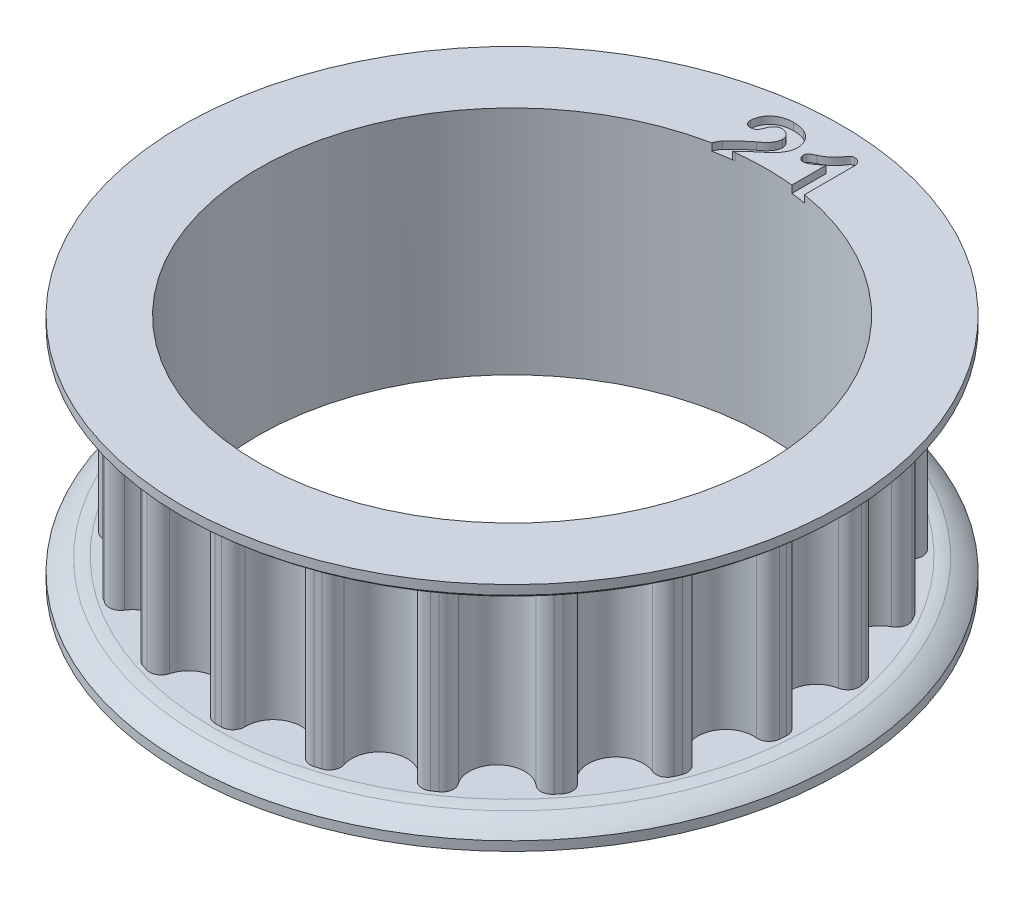
from build123d import *

# Parameters (mm, degrees)
SKETCH1_R               = 16.13976871
TOOTHOD_DEPTH           = 5.08
TOOTHPROFILE_DEPTH      = 25.984192363
TOOTHPATTERN_COUNT      = 21
BORE_DEPTH              = 27.384489599
BORE_DEPTH_BACK         = 27.384489599
SKETCH7_R               = 13.97
LARGE_TOOTH_COUNT_DEPTH = 0.4


with BuildPart() as part:
    # Sketch1 → ToothOD (new, symmetric)
    with BuildSketch(Plane(origin=(0, 0, 0), x_dir=(1, 0, 0), z_dir=(0, 1, 0))):
        Circle(SKETCH1_R)
    extrude(amount=TOOTHOD_DEPTH, both=True)

    # Sketch2 → ToothProfile (cut, through all)
    with BuildSketch(Plane(origin=(0, 5.08, 0), x_dir=(1, 0, 0), z_dir=(0, 1, 0))):
        with BuildLine():
            ThreePointArc((-1.514819148, 15.428848418), (0, 14.07976871), (1.514819148, 15.428848418))
            ThreePointArc((1.514819148, 15.428848418), (1.757165873, 15.857950358), (2.233452437, 15.984486987))
            ThreePointArc((2.233452437, 15.984486987), (0, 16.13976871), (-2.233452437, 15.984486987))
            ThreePointArc((-2.233452437, 15.984486987), (-1.757165873, 15.857950358), (-1.514819148, 15.428848418))
        make_face()
    toothprofile = extrude(amount=-TOOTHPROFILE_DEPTH, mode=Mode.SUBTRACT)

    # ToothPattern: ToothProfile ×21 about axis
    toothpattern_axis = Axis((0, 5.08, 0), (0, -1, 0))
    for i in range(1, TOOTHPATTERN_COUNT):
        add(toothprofile.rotate(toothpattern_axis, i * 360 / TOOTHPATTERN_COUNT), mode=Mode.SUBTRACT)

    # Sketch4 → Flange (revolve)
    with BuildSketch(Plane.XY):
        with BuildLine():
            Line((0, -5.08), (16.39376871, -5.08))
            ThreePointArc((16.39376871, -5.08), (16.7195247, -5.105622571), (17.039341039, -5.172637424))
            ThreePointArc((17.039341039, -5.172637424), (17.607069616, -5.454197125), (18.10826871, -5.842))
            Line((18.10826871, -5.842), (18.10826871, -6.35))
            Line((18.10826871, -6.35), (0, -6.35))
            Line((0, -6.35), (0, -5.08))
        make_face()
        with BuildLine():
            Line((18.10826871, 6.35), (18.10826871, 5.842))
            ThreePointArc((18.10826871, 5.842), (17.607069616, 5.454197125), (17.039341039, 5.172637424))
            ThreePointArc((17.039341039, 5.172637424), (16.7195247, 5.105622571), (16.39376871, 5.08))
            Line((16.39376871, 5.08), (0, 5.08))
            Line((0, 5.08), (0, 6.35))
            Line((0, 6.35), (18.10826871, 6.35))
        make_face()
    revolve(axis=Axis((0, 7.858125, 0), (0, -1, 0)))

    # Sketch7 → Bore (cut, two sides: drawn at the far end of the back side and taken through both)
    with BuildSketch(Plane.XZ.offset(-BORE_DEPTH_BACK)):
        Circle(SKETCH7_R)
    extrude(amount=BORE_DEPTH + BORE_DEPTH_BACK, mode=Mode.SUBTRACT)

    # Sketch9 → Large Tooth Count (cut)
    with BuildSketch(Plane(origin=(0, 6.35, 0), x_dir=(1, 0, 0), z_dir=(0, 1, 0))):
        with BuildLine():
            Line((-1.762125, 13.874923354), (-0.570755859, 13.874923354))
            add(Edge.make_bspline(
                [(-0.570755859, 13.874923354), (-0.533707207, 13.87398852), (-0.463545425, 13.872218156), (-0.365142268, 13.853642303), (-0.279792732, 13.823297538), (-0.208549734, 13.780908725), (-0.152090999, 13.729565586), (-0.111056396, 13.67153727), (-0.085797031, 13.607248318), (-0.082683368, 13.562107058), (-0.081111328, 13.539315932)],
                knots=[0, 0, 0, 0, 1.343135754, 2.543595783, 3.617176489, 4.61442092, 5.531765965, 6.365790276, 7.174912707, 8, 8, 8, 8], degree=3))
            add(Edge.make_bspline(
                [(-0.081111328, 13.539315932), (-0.082203127, 13.518835501), (-0.084392981, 13.477757305), (-0.104097817, 13.41789058), (-0.136223052, 13.361311518), (-0.17989453, 13.308411307), (-0.237387293, 13.262169059), (-0.311315716, 13.230655326), (-0.398880946, 13.211510069), (-0.46199946, 13.209332488), (-0.495597656, 13.208173354)],
                knots=[0, 0, 0, 0, 0.824179157, 1.653080055, 2.512971333, 3.436438535, 4.405072091, 5.457340227, 6.646533722, 8, 8, 8, 8], degree=3))
            Line((-0.495597656, 13.208173354), (-2.305347656, 13.208173354))
            add(Edge.make_bspline(
                [(-2.305347656, 13.208173354), (-2.337708251, 13.209585711), (-2.399445044, 13.212280174), (-2.487124104, 13.233091534), (-2.563929489, 13.269374607), (-2.628936518, 13.319379949), (-2.67994909, 13.379620035), (-2.717611602, 13.44590333), (-2.740998957, 13.517687637), (-2.743747646, 13.567670374), (-2.745134766, 13.592894057)],
                knots=[0, 0, 0, 0, 1.188346208, 2.267099395, 3.286301641, 4.287122075, 5.25691743, 6.166969209, 7.074964888, 8, 8, 8, 8], degree=3))
            add(Edge.make_bspline(
                [(-2.745134766, 13.592894057), (-2.744179889, 13.610580586), (-2.742139185, 13.648379169), (-2.72704257, 13.70774883), (-2.70583681, 13.773882187), (-2.675402152, 13.84383634), (-2.641188782, 13.913947291), (-2.603506466, 13.978442241), (-2.564081929, 14.035353764), (-2.534629659, 14.068174532), (-2.520404297, 14.08402687)],
                knots=[0, 0, 0, 0, 0.772497252, 1.650934469, 2.665768415, 3.807487169, 4.98083678, 6.074173258, 7.069831195, 8, 8, 8, 8], degree=3))
            add(Edge.make_bspline(
                [(-2.520404297, 14.08402687), (-2.466053132, 14.139560567), (-2.361152933, 14.246743107), (-2.205832985, 14.398276917), (-2.061164397, 14.53766544), (-1.945964026, 14.644447116), (-1.859956155, 14.722642098), (-1.801130055, 14.774408415), (-1.747617549, 14.821952202), (-1.697550942, 14.863044242), (-1.653169438, 14.900631234), (-1.612941668, 14.932596807), (-1.57736698, 14.959631323), (-1.554570298, 14.975096179), (-1.544091797, 14.982204604)],
                knots=[0, 0, 0, 0, 2.106460972, 4.065564631, 5.88232778, 7.552435621, 8.323665149, 9.033433807, 9.676767744, 10.26395234, 10.78914621, 11.253325952, 11.656791058, 12, 12, 12, 12], degree=3))
            add(Edge.make_bspline(
                [(-1.544091797, 14.982204604), (-1.512150488, 15.005011085), (-1.450036186, 15.049361449), (-1.362910525, 15.118140765), (-1.285488552, 15.187837086), (-1.215517545, 15.256252343), (-1.154259094, 15.325580203), (-1.101287219, 15.395509388), (-1.056278481, 15.465940278), (-1.018709146, 15.536455299), (-0.990117065, 15.607242181), (-0.96741796, 15.676560053), (-0.955657973, 15.745542042), (-0.953540426, 15.791049996), (-0.9525, 15.813409682)],
                knots=[0, 0, 0, 0, 1.334834965, 2.595771614, 3.772830874, 4.876488071, 5.92253324, 6.916378838, 7.85720954, 8.762924605, 9.629317751, 10.451189837, 11.239014127, 12, 12, 12, 12], degree=3))
            add(Edge.make_bspline(
                [(-0.9525, 15.813409682), (-0.95336502, 15.836539529), (-0.955052845, 15.881670448), (-0.968117239, 15.947580681), (-0.9896362, 16.009855495), (-1.020438978, 16.067574181), (-1.05762368, 16.12085656), (-1.101737406, 16.167955458), (-1.152277568, 16.208477239), (-1.208116574, 16.24252049), (-1.268172163, 16.270290822), (-1.332096405, 16.289379526), (-1.398736756, 16.301965511), (-1.444318349, 16.303181428), (-1.467445313, 16.303798354)],
                knots=[0, 0, 0, 0, 1.048524963, 2.045880207, 3.035079073, 4.026514865, 5.003545842, 5.974663832, 6.942844473, 7.932746918, 8.934660944, 9.934741294, 10.952139253, 12, 12, 12, 12], degree=3))
            add(Edge.make_bspline(
                [(-1.467445313, 16.303798354), (-1.488603837, 16.303246673), (-1.530328923, 16.302158745), (-1.591038054, 16.288605382), (-1.649193485, 16.268537667), (-1.704582037, 16.24000902), (-1.757128938, 16.202914471), (-1.806805489, 16.158002476), (-1.854552156, 16.105553337), (-1.88191115, 16.065543697), (-1.896070313, 16.044837416)],
                knots=[0, 0, 0, 0, 0.968576666, 1.910054901, 2.83824492, 3.784521401, 4.756498814, 5.779585462, 6.850863807, 8, 8, 8, 8], degree=3))
            add(Edge.make_bspline(
                [(-1.896070313, 16.044837416), (-1.898884837, 16.039169206), (-1.90725541, 16.022311594), (-1.919621651, 15.986084258), (-1.941429436, 15.932681203), (-1.964571994, 15.863127936), (-1.994294675, 15.788413168), (-2.02891906, 15.716314224), (-2.069030563, 15.652017002), (-2.110038336, 15.592107905), (-2.163240409, 15.542668437), (-2.230788188, 15.508340165), (-2.311915747, 15.488389198), (-2.370213456, 15.486338596), (-2.401341797, 15.485243666)],
                knots=[0, 0, 0, 0, 0.277128514, 0.824197545, 1.674066046, 2.805212172, 4.034469565, 5.196326461, 6.303667431, 7.353778336, 8.369399301, 9.448751033, 10.637748383, 12, 12, 12, 12], degree=3))
            add(Edge.make_bspline(
                [(-2.401341797, 15.485243666), (-2.424271026, 15.486353646), (-2.469130374, 15.488525239), (-2.533582425, 15.506574301), (-2.591105186, 15.538155264), (-2.642025052, 15.579899622), (-2.684486339, 15.632087381), (-2.713078119, 15.694699146), (-2.731809009, 15.76445846), (-2.73372109, 15.813773847), (-2.734716797, 15.839454604)],
                knots=[0, 0, 0, 0, 1.006577142, 1.969294067, 2.910545259, 3.870728958, 4.847838899, 5.837573602, 6.873926541, 8, 8, 8, 8], degree=3))
            add(Edge.make_bspline(
                [(-2.734716797, 15.839454604), (-2.733654173, 15.870272421), (-2.731508455, 15.932501712), (-2.715647187, 16.02641007), (-2.691165523, 16.121886301), (-2.656366941, 16.218238432), (-2.61099031, 16.312760147), (-2.556929288, 16.404438131), (-2.490968298, 16.489845053), (-2.417939183, 16.572390484), (-2.333218402, 16.647662124), (-2.237995489, 16.715825835), (-2.132080587, 16.775743586), (-2.016058379, 16.828333575), (-1.889529964, 16.870768082), (-1.752593036, 16.900820117), (-1.60590276, 16.920010724), (-1.504715272, 16.921932735), (-1.4525625, 16.922923354)],
                knots=[0, 0, 0, 0, 0.79066067, 1.596552158, 2.438066046, 3.318094126, 4.22076533, 5.12585777, 6.043865989, 6.985993145, 7.950839248, 8.945468985, 9.986194989, 11.068910188, 12.21037173, 13.404260134, 14.66213667, 16, 16, 16, 16], degree=3))
            add(Edge.make_bspline(
                [(-1.4525625, 16.922923354), (-1.419313755, 16.922468154), (-1.354251016, 16.921577398), (-1.258683499, 16.915382026), (-1.167205964, 16.906195634), (-1.079873649, 16.891678454), (-0.996460634, 16.874347587), (-0.917374073, 16.851581312), (-0.842094469, 16.826080755), (-0.794362208, 16.805187832), (-0.770929688, 16.794931166)],
                knots=[0, 0, 0, 0, 1.141710532, 2.234153931, 3.287715026, 4.297387598, 5.273071892, 6.211454997, 7.121975032, 8, 8, 8, 8], degree=3))
            add(Edge.make_bspline(
                [(-0.770929688, 16.794931166), (-0.737844503, 16.778689088), (-0.67280231, 16.746758773), (-0.5825276, 16.688840779), (-0.500121613, 16.625023812), (-0.427116332, 16.553849783), (-0.362358815, 16.477519254), (-0.304287189, 16.397223162), (-0.256045848, 16.310722103), (-0.215247684, 16.220671783), (-0.183300557, 16.127674135), (-0.160232052, 16.033549748), (-0.145256758, 15.938657135), (-0.143668356, 15.874980009), (-0.142875, 15.843175307)],
                knots=[0, 0, 0, 0, 1.100471427, 2.163417708, 3.198242748, 4.209796447, 5.203380146, 6.186404149, 7.165424876, 8.157237974, 9.136931722, 10.098602738, 11.050312444, 12, 12, 12, 12], degree=3))
            add(Edge.make_bspline(
                [(-0.142875, 15.843175307), (-0.144693042, 15.793175923), (-0.148288338, 15.69429892), (-0.1782964, 15.549150428), (-0.227637669, 15.410508707), (-0.295917887, 15.281042845), (-0.373499735, 15.162518378), (-0.451858766, 15.054395038), (-0.532509928, 14.961301112), (-0.602079602, 14.891836904), (-0.661927162, 14.839944468), (-0.71198559, 14.7964842), (-0.768326496, 14.748400074), (-0.831144563, 14.695093673), (-0.901057651, 14.637601356), (-0.976718868, 14.574007501), (-1.059338558, 14.506612059), (-1.146105933, 14.435918207), (-1.233051854, 14.364971252), (-1.314376052, 14.294877474), (-1.389833251, 14.229756169), (-1.4579485, 14.16759103), (-1.519166092, 14.108979255), (-1.574924824, 14.055043739), (-1.622231717, 14.003363641), (-1.651539483, 13.970210491), (-1.665386719, 13.954546401)],
                knots=[0, 0, 0, 0, 1.436599664, 2.840968415, 4.241909903, 5.655071448, 7.037977016, 8.313294046, 9.491515882, 10.57584574, 11.13676856, 11.768818006, 12.482089669, 13.266552005, 14.137751607, 15.08474532, 16.108481255, 17.203478555, 18.302996106, 19.33499709, 20.290440541, 21.168908746, 21.986178864, 22.727567017, 23.398805086, 24, 24, 24, 24], degree=3))
            add(Edge.make_bspline(
                [(-1.665386719, 13.954546401), (-1.67937404, 13.940422035), (-1.708903168, 13.910603585), (-1.743772519, 13.887226966), (-1.762125, 13.874923354)],
                knots=[0, 0, 0, 0, 0.947357495, 2, 2, 2, 2], degree=3))
        make_face()
        with BuildLine():
            Line((1.476375, 13.604056166), (1.476375, 15.779923354))
            add(Edge.make_bspline(
                [(1.476375, 15.779923354), (1.433479942, 15.742404022), (1.351801185, 15.67096147), (1.231124831, 15.573855748), (1.118877324, 15.491511634), (1.014858251, 15.424250162), (0.91959762, 15.371343071), (0.832873441, 15.333454932), (0.754394942, 15.308947935), (0.704095207, 15.305338583), (0.680888672, 15.303673354)],
                knots=[0, 0, 0, 0, 1.452107273, 2.765034543, 3.945897232, 4.997908399, 5.920070119, 6.718510474, 7.408765629, 8, 8, 8, 8], degree=3))
            add(Edge.make_bspline(
                [(0.680888672, 15.303673354), (0.660648096, 15.30474504), (0.62082535, 15.306853551), (0.563344568, 15.32602751), (0.509769291, 15.356301097), (0.461562481, 15.397678489), (0.420626666, 15.446753855), (0.391395595, 15.502103467), (0.372329937, 15.561153466), (0.370180192, 15.602177097), (0.36909375, 15.622909682)],
                knots=[0, 0, 0, 0, 0.982678269, 1.933390929, 2.917255113, 3.962257531, 5.008793131, 6.008019064, 6.993289668, 8, 8, 8, 8], degree=3))
            add(Edge.make_bspline(
                [(0.36909375, 15.622909682), (0.370251069, 15.646067612), (0.37243709, 15.689809852), (0.388189288, 15.750863632), (0.417435579, 15.801508307), (0.459981689, 15.841833093), (0.515171558, 15.876625624), (0.5819013, 15.914975223), (0.66255745, 15.95774059), (0.721920377, 15.985353382), (0.753814453, 16.000188979)],
                knots=[0, 0, 0, 0, 0.959800551, 1.812935176, 2.587130183, 3.350598702, 4.217563363, 5.286346087, 6.542028024, 8, 8, 8, 8], degree=3))
            add(Edge.make_bspline(
                [(0.753814453, 16.000188979), (0.800242248, 16.02270018), (0.889371027, 16.065915583), (1.013182235, 16.137073568), (1.123367651, 16.208566207), (1.219203096, 16.284425074), (1.305551889, 16.363664965), (1.386414567, 16.446340844), (1.461912646, 16.535024433), (1.530806341, 16.625266077), (1.5911005, 16.710227626), (1.643699201, 16.779799664), (1.684835404, 16.831855357), (1.715755856, 16.870868684), (1.749767884, 16.896809257), (1.792199878, 16.912487803), (1.844810487, 16.921754558), (1.883373089, 16.922512763), (1.904255859, 16.922923354)],
                knots=[0, 0, 0, 0, 1.633066382, 3.135044738, 4.518110351, 5.78750681, 6.999314836, 8.226621731, 9.446368142, 10.684082489, 11.819758467, 12.744847819, 13.443941736, 13.922653104, 14.315303366, 14.780490369, 15.339600077, 16, 16, 16, 16], degree=3))
            add(Edge.make_bspline(
                [(1.904255859, 16.922923354), (1.933941208, 16.92171313), (1.990602989, 16.919403119), (2.070017529, 16.895947708), (2.137731693, 16.856482016), (2.191636196, 16.801257583), (2.233653302, 16.736347768), (2.264845823, 16.663728438), (2.282846394, 16.583473103), (2.284925409, 16.527628102), (2.286, 16.498763198)],
                knots=[0, 0, 0, 0, 1.104026993, 2.107306726, 3.052283825, 3.993636142, 4.95520013, 5.920268712, 6.92503816, 8, 8, 8, 8], degree=3))
            Line((2.286, 16.498763198), (2.286, 13.699306166))
            add(Edge.make_bspline(
                [(2.286, 13.699306166), (2.284900007, 13.657045023), (2.282834285, 13.577681079), (2.262991506, 13.46696266), (2.230106194, 13.372267781), (2.181958966, 13.294515431), (2.11973, 13.233082327), (2.043169572, 13.190269386), (1.95328428, 13.164250097), (1.88906682, 13.16182792), (1.855142578, 13.160548354)],
                knots=[0, 0, 0, 0, 1.286563032, 2.416089802, 3.413012509, 4.323048118, 5.178141009, 6.048034207, 6.968832458, 8, 8, 8, 8], degree=3))
            add(Edge.make_bspline(
                [(1.855142578, 13.160548354), (1.827947849, 13.161911233), (1.775361381, 13.164546634), (1.700686388, 13.186841219), (1.634397972, 13.223311674), (1.57713446, 13.273801359), (1.530670437, 13.338367923), (1.499492636, 13.41656903), (1.479660839, 13.506338548), (1.477513339, 13.57020308), (1.476375, 13.604056166)],
                knots=[0, 0, 0, 0, 0.988661812, 1.911776046, 2.809258143, 3.724383738, 4.669377512, 5.677528055, 6.768912233, 8, 8, 8, 8], degree=3))
        make_face()
    extrude(amount=-LARGE_TOOTH_COUNT_DEPTH, mode=Mode.SUBTRACT)


solid = part.part
